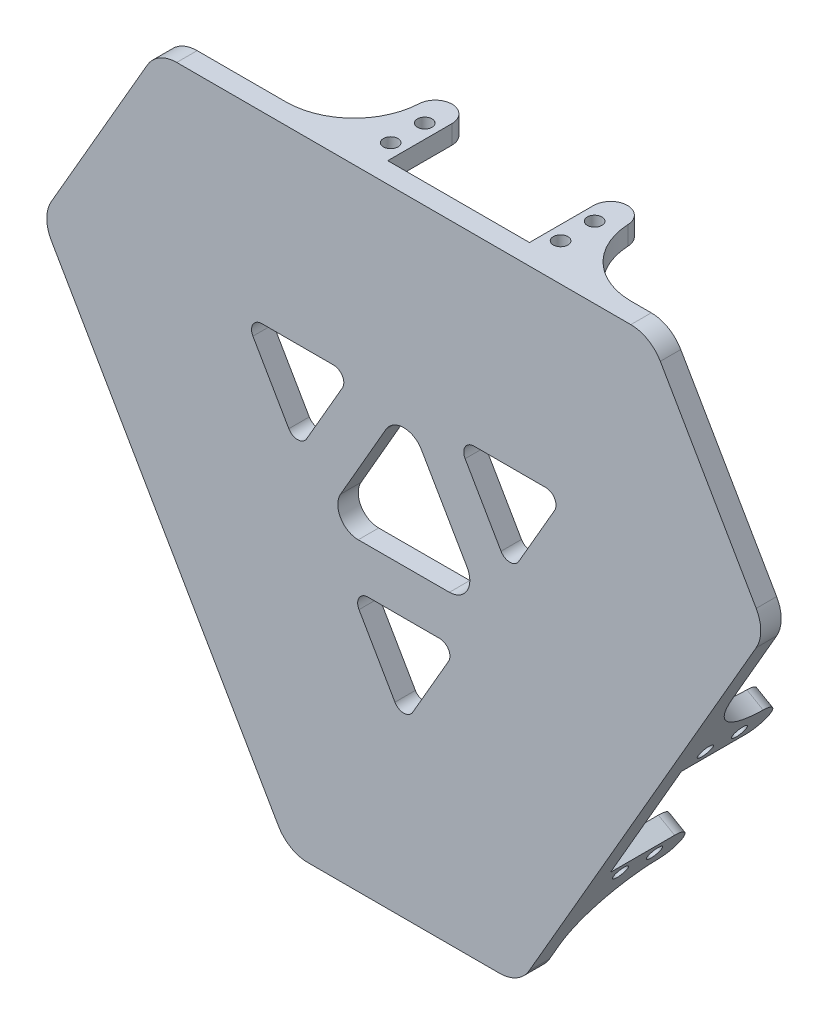
from build123d import *

# Parameters (mm, degrees)
SKETCH3_W              = 73.802028427
SKETCH3_H              = 33.55074113
BOSS_EXTRUDE1_DEPTH    = 5
BOSS_EXTRUDE2_DEPTH    = 6
CUT_EXTRUDE1_OUTLINE_W = 73.802028427
CUT_EXTRUDE1_OUTLINE_H = 33.55074113
CUT_EXTRUDE1_DEPTH     = 5
SKETCH11_W             = 9.910304241
SKETCH11_H             = 23.835167919
SKETCH11_R             = 2.15
BOSS_EXTRUDE3_DEPTH    = 5.5
BOSS_EXTRUDE3_2_DEPTH  = 5.5
CIRPATTERN3_COUNT      = 3
FILLET3_R              = 5
FILLET4_R              = 20
CUT_EXTRUDE2_DEPTH     = 10
CUT_EXTRUDE3_DEPTH     = 10
FILLET5_R              = 10
FILLET6_R              = 10


# Read off the part's stored shape, not the designer's step: Cut-Extrude1
with BuildPart() as part:
    # Sketch3 → Boss-Extrude1 (new body)
    with BuildSketch(Plane.XY):
        with Locations((2.875089275, 11.32460742)):
            Rectangle(SKETCH3_W, SKETCH3_H)
    extrude(amount=BOSS_EXTRUDE1_DEPTH)

    # Sketch4 → Boss-Extrude2 (add)
    with BuildSketch(Plane.XY.offset(5)):
        with BuildLine():
            Line((-88.363175499, 81.016503161), (88.363175499, 81.016503161))
            ThreePointArc((88.363175499, 81.016503161), (114.343937613, 66.016503161), (114.343937613, 36.016503161))
            Line((114.343937613, 36.016503161), (25.980762114, -117.033006322))
            ThreePointArc((25.980762114, -117.033006322), (0, -132.033006322), (-25.980762114, -117.033006322))
            Line((-25.980762114, -117.033006322), (-114.343937613, 36.016503161))
            ThreePointArc((-114.343937613, 36.016503161), (-114.343937613, 66.016503161), (-88.363175499, 81.016503161))
        make_face()
    extrude(amount=BOSS_EXTRUDE2_DEPTH)

    # Cut-Extrude1 outline → Cut-Extrude1 (cut)
    with BuildSketch(Plane(origin=(0, 0, 5), x_dir=(-1, 0, 0), z_dir=(0, 0, -1))):
        with Locations((-2.875089275, 11.32460742)):
            Rectangle(CUT_EXTRUDE1_OUTLINE_W, CUT_EXTRUDE1_OUTLINE_H)
    extrude(amount=CUT_EXTRUDE1_DEPTH, mode=Mode.SUBTRACT)


with BuildPart() as body_2:
    # Sketch11 → Boss-Extrude3 (new body)
    with BuildSketch(Plane(origin=(0, 81.016503161, 0), x_dir=(1, 0, 0), z_dir=(0, 1, 0))):
        with Locations((-15.667013432, 6.917583959)):
            Rectangle(SKETCH11_W, SKETCH11_H)
        with Locations(Location((-14.850000449, 9.993341923, 0), (0, 0, 180))):
            Circle(SKETCH11_R, mode=Mode.SUBTRACT)
        with Locations(Location((-14.850000449, 0, 0), (0, 0, 180))):
            Circle(SKETCH11_R, mode=Mode.SUBTRACT)
    extrude(amount=-BOSS_EXTRUDE3_DEPTH)


with BuildPart() as body_3:
    # Sketch11 → Boss-Extrude3 2 (new body)
    with BuildSketch(Plane(origin=(0, 81.016503161, 0), x_dir=(1, 0, 0), z_dir=(0, 1, 0))):
        with Locations((35.867012534, 6.917583959)):
            Rectangle(SKETCH11_W, SKETCH11_H)
        with Locations(Location((35.049999551, 9.993341923, 0), (0, 0, 180))):
            Circle(SKETCH11_R, mode=Mode.SUBTRACT)
        with Locations(Location((35.049999551, 0, 0), (0, 0, 180))):
            Circle(SKETCH11_R, mode=Mode.SUBTRACT)
    extrude(amount=-BOSS_EXTRUDE3_2_DEPTH)


with BuildPart() as cirpattern3_1:
    # CirPattern3: pattern copy
    add(body_3.part.rotate(Axis((0, 0, 0), (0, 0, 1)), 1 * 360 / CIRPATTERN3_COUNT))


with BuildPart() as cirpattern3_2:
    # CirPattern3: pattern copy
    add(body_3.part.rotate(Axis((0, 0, 0), (0, 0, 1)), 2 * 360 / CIRPATTERN3_COUNT))


with BuildPart() as cirpattern3_3:
    # CirPattern3: pattern copy
    add(body_2.part.rotate(Axis((0, 0, 0), (0, 0, 1)), 1 * 360 / CIRPATTERN3_COUNT))


with BuildPart() as cirpattern3_4:
    # CirPattern3: pattern copy
    add(body_2.part.rotate(Axis((0, 0, 0), (0, 0, 1)), 2 * 360 / CIRPATTERN3_COUNT))


with BuildPart() as part_1:
    add(part.part)

    # Combine1: union CirPattern3_1, CirPattern3_3, CirPattern3_2, CirPattern3_4, body 3, body 2
    add(cirpattern3_1.part)
    add(cirpattern3_3.part)
    add(cirpattern3_2.part)
    add(cirpattern3_4.part)
    add(body_3.part)
    add(body_2.part)

    # Fillet3
    # the kernel refuses this fillet: 5 mm, written as the material it takes off along each edge
    with BuildSketch(Plane(origin=(30.911860413, 93.516503161, -18.835167919), x_dir=(0, 0, 1), z_dir=(0, -1, 0)), Plane(origin=(-20.622165552, 93.516503161, -18.835167919), x_dir=(0, 0, 1), z_dir=(0, -1, 0)), Plane(origin=(91.298750186, -28.898932331, -18.835167919), x_dir=(0, 0, 1), z_dir=(-0.866025403784445, 0.4999999999999889, 0)), Plane(origin=(65.531737204, -73.528707976, -18.835167919), x_dir=(0, 0, 1), z_dir=(-0.866025403784445, 0.4999999999999889, 0)), Plane(origin=(-96.443597617, -19.987795185, -18.835167919), x_dir=(0, 0, 1), z_dir=(0.8660254037844322, 0.5000000000000114, 0)), Plane(origin=(-70.676584634, -64.61757083, -18.835167919), x_dir=(0, 0, 1), z_dir=(0.8660254037844322, 0.5000000000000114, 0))) as fillet3_piece_1:
        with BuildLine():
            CenterArc((FILLET3_R, -FILLET3_R), FILLET3_R, 90, 90)
            Line((0, -FILLET3_R), (0, 0))
            Line((0, 0), (FILLET3_R, 0))
        make_face()
    extrude(amount=30.5, mode=Mode.SUBTRACT)
    with BuildSketch(Plane(origin=(40.822164654, 93.516503161, -18.835167919), x_dir=(0, 0, 1), z_dir=(0, -1, 0)), Plane(origin=(-10.711861311, 93.516503161, -18.835167919), x_dir=(0, 0, 1), z_dir=(0, -1, 0)), Plane(origin=(86.343598066, -37.481507563, -18.835167919), x_dir=(0, 0, 1), z_dir=(-0.866025403784445, 0.4999999999999889, 0)), Plane(origin=(60.576585084, -82.111283208, -18.835167919), x_dir=(0, 0, 1), z_dir=(-0.866025403784445, 0.4999999999999889, 0)), Plane(origin=(-101.398749737, -11.405219953, -18.835167919), x_dir=(0, 0, 1), z_dir=(0.8660254037844322, 0.5000000000000114, 0)), Plane(origin=(-75.631736755, -56.034995598, -18.835167919), x_dir=(0, 0, 1), z_dir=(0.8660254037844322, 0.5000000000000114, 0))) as fillet3_piece_2:
        with BuildLine():
            CenterArc((FILLET3_R, FILLET3_R), FILLET3_R, 180, 90)
            Line((0, FILLET3_R), (0, 0))
            Line((0, 0), (FILLET3_R, 0))
        make_face()
    extrude(amount=30.5, mode=Mode.SUBTRACT)

    # Fillet4
    # the kernel refuses this fillet: 20 mm, written as the material it adds along each edge
    with BuildSketch(Plane(origin=(80.473432639, -22.648932331, 5), x_dir=(0.4999999999999889, 0.866025403784445, 0), z_dir=(-0.866025403784445, 0.4999999999999889, 0)), Plane(origin=(-59.851267087, -58.36757083, 5), x_dir=(0.5000000000000114, -0.8660254037844322, 0), z_dir=(0.8660254037844322, 0.5000000000000113, 0)), Plane(origin=(-20.622165552, 81.016503161, 5), x_dir=(-1, 0, 0), z_dir=(0, -1, 0))) as fillet4_piece_1:
        with BuildLine():
            CenterArc((19.97284858, 20), FILLET4_R, 182.670565348, 87.329434652)
            Line((-0.005430284, 19.068134335), (-2.00325817, 18.974947769))
            ThreePointArc((-2.00325817, 18.974947769), (-2, 18.835167919), (-2, 0))
            Line((-2, 0), (0, -2))
            Line((0, -2), (19.97284858, -2))
            Line((19.97284858, -2), (19.97284858, 0))
        make_face()
    extrude(amount=5.5)
    with BuildSketch(Plane(origin=(49.751267536, -75.861283208, 5), x_dir=(-0.4999999999999889, -0.8660254037844451, 0), z_dir=(-0.866025403784445, 0.4999999999999889, 0)), Plane(origin=(-90.57343219, -5.155219953, 5), x_dir=(-0.5000000000000113, 0.8660254037844322, 0), z_dir=(0.8660254037844322, 0.5000000000000113, 0)), Plane(origin=(40.822164654, 81.016503161, 5), x_dir=(1, 0, 0), z_dir=(0, -1, 0))) as fillet4_piece_2:
        with BuildLine():
            CenterArc((19.97284858, -20), FILLET4_R, 90, 87.329434652)
            Line((-0.005430284, -19.068134335), (-2.00325817, -18.974947769))
            ThreePointArc((-2.00325817, -18.974947769), (-2, -18.835167919), (-2, 0))
            Line((-2, 0), (0, 2))
            Line((0, 2), (19.97284858, 2))
            Line((19.97284858, 2), (19.97284858, 0))
        make_face()
    extrude(amount=5.5)

    # Sketch13 → Cut-Extrude2 (cut)
    with BuildSketch(Plane.XY.offset(11)):
        with BuildLine():
            Line((-5.215723818, 18.4505975), (-18.576519023, -4.747764108))
            ThreePointArc((-18.576519023, -4.747764108), (-18.570155502, -10.747760733), (-13.370824241, -13.742248075))
            Line((-13.370824241, -13.742248075), (13.39994384, -13.713855334))
            ThreePointArc((13.39994384, -13.713855334), (18.59291158, -10.70834605), (18.586548059, -4.708349425))
            Line((18.586548059, -4.708349425), (5.176575183, 18.461619442))
            ThreePointArc((5.176575183, 18.461619442), (-0.022756078, 21.456106783), (-5.215723818, 18.4505975))
        make_face()
        with BuildLine():
            Line((-44.30857639, 22.581568506), (-33.761718484, 4.313874753))
            ThreePointArc((-33.761718484, 4.313874753), (-31.163642273, 2.813874753), (-28.565566061, 4.313874753))
            Line((-28.565566061, 4.313874753), (-18.018708156, 22.581568506))
            ThreePointArc((-18.018708156, 22.581568506), (-18.018708156, 25.581568506), (-20.616784367, 27.081568506))
            Line((-20.616784367, 27.081568506), (-41.710500179, 27.081568506))
            ThreePointArc((-41.710500179, 27.081568506), (-44.30857639, 25.581568506), (-44.30857639, 22.581568506))
        make_face()
        with BuildLine():
            Line((2.598076211, -49.663137012), (13.144934117, -31.395443259))
            ThreePointArc((13.144934117, -31.395443259), (13.144934117, -28.395443259), (10.546857906, -26.895443259))
            Line((10.546857906, -26.895443259), (-10.546857906, -26.895443259))
            ThreePointArc((-10.546857906, -26.895443259), (-13.144934117, -28.395443259), (-13.144934117, -31.395443259))
            Line((-13.144934117, -31.395443259), (-2.598076211, -49.663137012))
            ThreePointArc((-2.598076211, -49.663137012), (0, -51.163137012), (2.598076211, -49.663137012))
        make_face()
        with BuildLine():
            Line((41.710500179, 27.081568506), (20.616784367, 27.081568506))
            ThreePointArc((20.616784367, 27.081568506), (18.018708156, 25.581568506), (18.018708156, 22.581568506))
            Line((18.018708156, 22.581568506), (28.565566061, 4.313874753))
            ThreePointArc((28.565566061, 4.313874753), (31.163642273, 2.813874753), (33.761718484, 4.313874753))
            Line((33.761718484, 4.313874753), (44.30857639, 22.581568506))
            ThreePointArc((44.30857639, 22.581568506), (44.30857639, 25.581568506), (41.710500179, 27.081568506))
        make_face()
    extrude(amount=-CUT_EXTRUDE2_DEPTH, mode=Mode.SUBTRACT)

    # Sketch14 → Cut-Extrude3 (cut)
    with BuildSketch(Plane(origin=(0, 0, 5), x_dir=(-1, 0, 0), z_dir=(0, 0, -1))):
        with BuildLine():
            Line((-72.464929389, 81.016503161), (-106.394814558, 22.248218154))
            Line((-106.394814558, 22.248218154), (-114.343937613, 36.016503161))
            ThreePointArc((-114.343937613, 36.016503161), (-114.343937613, 66.016503161), (-88.363175499, 81.016503161))
            Line((-88.363175499, 81.016503161), (-72.464929389, 81.016503161))
        make_face()
        with BuildLine():
            Line((106.394814558, 22.248218154), (72.464929389, 81.016503161))
            Line((72.464929389, 81.016503161), (88.363175499, 81.016503161))
            ThreePointArc((88.363175499, 81.016503161), (114.343937613, 66.016503161), (114.343937613, 36.016503161))
            Line((114.343937613, 36.016503161), (106.394814558, 22.248218154))
        make_face()
        with BuildLine():
            Line((-33.929885169, -103.264721315), (33.929885169, -103.264721315))
            Line((33.929885169, -103.264721315), (25.980762114, -117.033006322))
            ThreePointArc((25.980762114, -117.033006322), (0, -132.033006322), (-25.980762114, -117.033006322))
            Line((-25.980762114, -117.033006322), (-33.929885169, -103.264721315))
        make_face()
    extrude(amount=-CUT_EXTRUDE3_DEPTH, mode=Mode.SUBTRACT)

    # Fillet5
    fillet5_edges = [part_1.edges().sort_by_distance(p)[0] for p in [
        (72.464929389, 81.016503161, 8),
    ]]
    fillet(fillet5_edges, radius=FILLET5_R)

    # Fillet6
    fillet6_edges = [part_1.edges().sort_by_distance(p)[0] for p in [
        (106.394814558, 22.248218154, 8),
        (-72.464929389, 81.016503161, 8),
        (-106.394814558, 22.248218154, 8),
        (-33.929885169, -103.264721315, 8),
        (33.929885169, -103.264721315, 8),
    ]]
    fillet(fillet6_edges, radius=FILLET6_R)


solid = part_1.part
